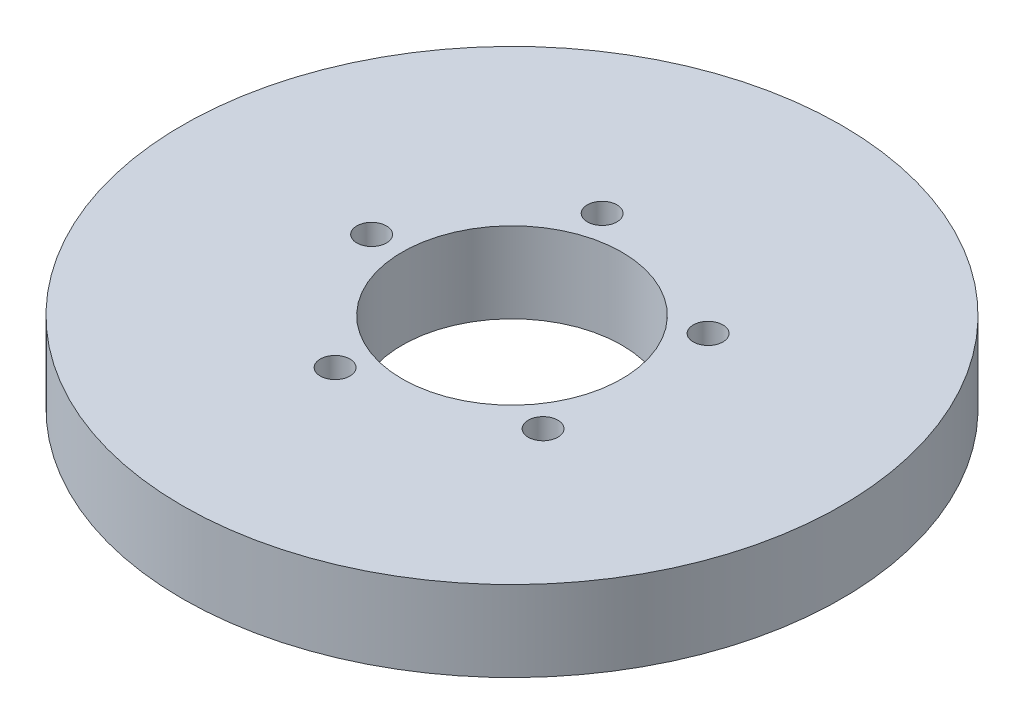
from build123d import *

# Parameters (mm, degrees)
SKETCH1_R           = 45
BOSS_EXTRUDE1_DEPTH = 11
SKETCH2_R           = 15
CUT_EXTRUDE1_DEPTH  = 65.58327957
SKETCH3_R           = 2.02380195
CUT_EXTRUDE2_DEPTH  = 8.742203499
CIRPATTERN1_COUNT   = 5


with BuildPart() as part:
    # Sketch1 → Boss-Extrude1 (new body)
    with BuildSketch(Plane(origin=(0, 0, 0), x_dir=(1, 0, 0), z_dir=(0, 1, 0))):
        Circle(SKETCH1_R)
    extrude(amount=BOSS_EXTRUDE1_DEPTH)

    # Sketch2 → Cut-Extrude1 (cut, through all)
    with BuildSketch(Plane(origin=(0, 0, 0), x_dir=(1, 0, 0), z_dir=(0, 1, 0))):
        Circle(SKETCH2_R)
    extrude(amount=CUT_EXTRUDE1_DEPTH, mode=Mode.SUBTRACT)

    # Sketch3 → Cut-Extrude2 (cut)
    with BuildSketch(Plane(origin=(0, 11, 0), x_dir=(1, 0, 0), z_dir=(0, 1, 0))):
        with Locations((-19.168812802, 0)):
            Circle(SKETCH3_R)
    cut_extrude2 = extrude(amount=-CUT_EXTRUDE2_DEPTH, mode=Mode.SUBTRACT)

    # CirPattern1: Cut-Extrude2 ×5 about axis
    cirpattern1_axis = Axis((0, 0, 0), (0, 1, 0))
    for i in range(1, CIRPATTERN1_COUNT):
        add(cut_extrude2.rotate(cirpattern1_axis, i * 360 / CIRPATTERN1_COUNT), mode=Mode.SUBTRACT)


solid = part.part
